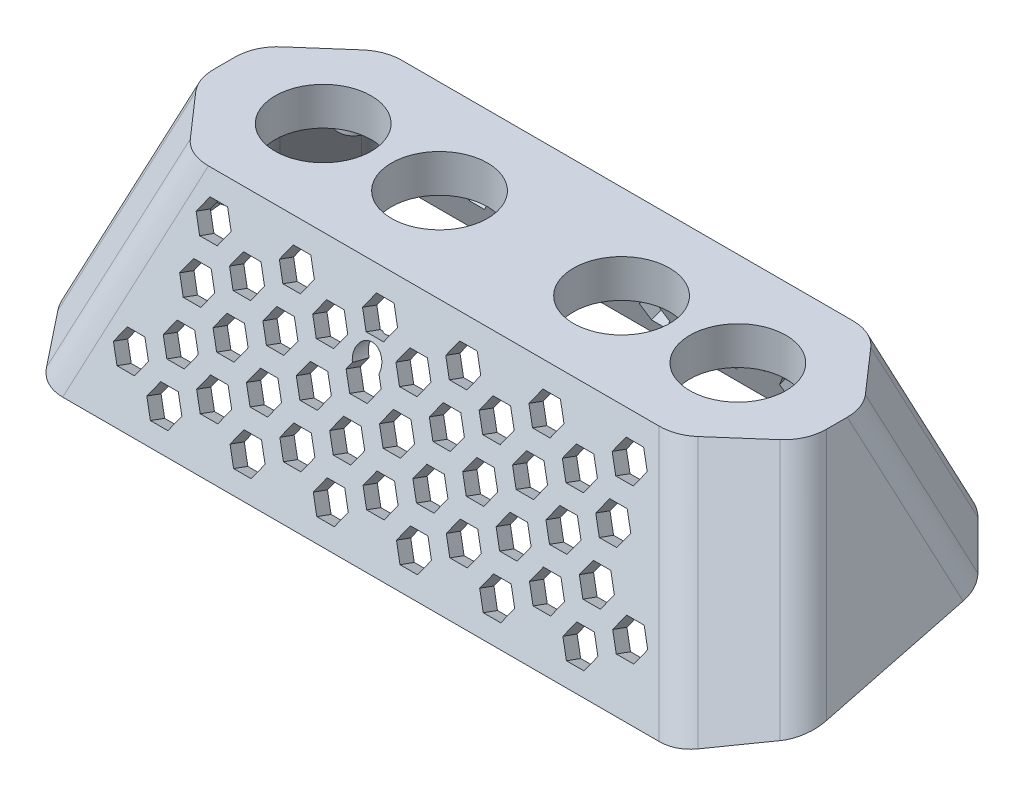
from build123d import *
from OCP.BRepFilletAPI import BRepFilletAPI_MakeChamfer

# Parameters (mm, degrees)
SKETCH1_W               = 118
SKETCH1_H               = 33
BOSS_EXTRUDE1_DEPTH     = 36
BOSS_EXTRUDE1_DRAFT     = 20
CHAMFER1_SIZE           = 10
CHAMFER1_SIZE2          = 11.413482753
CUT_EXTRUDE1_DEPTH      = 86.855492897
CUT_EXTRUDE1_DEPTH_BACK = 86.855492897
FILLET1_R               = 6
SHELL1_T                = 3
CUT_EXTRUDE2_REACH      = 91.279
SKETCH3_R               = 9.5
SKETCH4_R               = 3
SKETCH4_R_2             = 1.55
BOSS_EXTRUDE2_DEPTH     = 6
BOSS_EXTRUDE3_START     = -4.5
SKETCH5_R               = 10.5
SKETCH5_R_2             = 9.5
BOSS_EXTRUDE3_DEPTH     = 4.5
SKETCH6_W               = 12
SKETCH6_H               = 10
CUT_EXTRUDE3_DEPTH      = 90.278569771
FILL_START              = 15.504928243
FILL_PATTERN1_DEPTH     = 3
FILL_PATTERN3_DEPTH     = 3
SKETCH7_R               = 2.75
CUT_EXTRUDE4_DEPTH      = 90.278569771
CHAMFER2_SIZE           = 1


with BuildPart() as part:
    # Sketch1 → Boss-Extrude1 (with draft: the straight prism first)
    with BuildSketch(Plane(origin=(0, 0, 0), x_dir=(1, 0, 0), z_dir=(0, 1, 0))):
        Rectangle(SKETCH1_W, SKETCH1_H)
    extrude(amount=-BOSS_EXTRUDE1_DEPTH)
    # Boss-Extrude1: the draft: its side faces are tilted about the plane it starts from
    boss_extrude1_sides = [part.faces().sort_by_distance(p)[0] for p in [
        (0, -18, 16.5),
        (59, -18, 0),
        (0, -18, -16.5),
        (-59, -18, 0),
    ]]
    draft(boss_extrude1_sides, Plane(origin=(0, 0, 0), x_dir=(1, 0, 0), z_dir=(0, 1, 0)), BOSS_EXTRUDE1_DRAFT)

    # Chamfer1: one chamfer whose edges measure the first distance from different faces: ONE call of the kernel's chamfer builder (chamfer() names one face for all edges)
    chamfer1_edges_1 = [part.edges().sort_by_distance(p)[0] for p in [
        (-65.551464217, -18, -23.051464217),
    ]]
    chamfer1_side_1 = [part.faces().sort_by_distance(p)[0] for p in [
        (-66.172128816, -19.705261971, 0),
    ]]
    chamfer1_edges_2 = [part.edges().sort_by_distance(p)[0] for p in [
        (65.551464217, -18, -23.051464217),
    ]]
    chamfer1_side_2 = [part.faces().sort_by_distance(p)[0] for p in [
        (0, -18.599662964, -23.269723686),
    ]]
    chamfer1_edges_3 = [part.edges().sort_by_distance(p)[0] for p in [
        (65.551464217, -18, 23.051464217),
    ]]
    chamfer1_side_3 = [part.faces().sort_by_distance(p)[0] for p in [
        (66.172128816, -19.705261971, 0),
    ]]
    chamfer1_edges_4 = [part.edges().sort_by_distance(p)[0] for p in [
        (-65.551464217, -18, 23.051464217),
    ]]
    chamfer1_side_4 = [part.faces().sort_by_distance(p)[0] for p in [
        (0, -18.599662964, 23.269723686),
    ]]
    chamfer1 = BRepFilletAPI_MakeChamfer(part.part.solid().wrapped)
    for e in chamfer1_edges_1:
        chamfer1.Add(CHAMFER1_SIZE, CHAMFER1_SIZE2, e.wrapped, chamfer1_side_1[0].wrapped)  # the first distance lies on this face
    for e in chamfer1_edges_2:
        chamfer1.Add(CHAMFER1_SIZE, CHAMFER1_SIZE2, e.wrapped, chamfer1_side_2[0].wrapped)  # the first distance lies on this face
    for e in chamfer1_edges_3:
        chamfer1.Add(CHAMFER1_SIZE, CHAMFER1_SIZE2, e.wrapped, chamfer1_side_3[0].wrapped)  # the first distance lies on this face
    for e in chamfer1_edges_4:
        chamfer1.Add(CHAMFER1_SIZE, CHAMFER1_SIZE2, e.wrapped, chamfer1_side_4[0].wrapped)  # the first distance lies on this face
    add(Compound.cast(chamfer1.Shape()), mode=Mode.REPLACE)

    # Sketch2 → Cut-Extrude1 (cut, two sides: drawn at the far end of the back side and taken through both)
    with BuildSketch(Plane(origin=(0, 0, 0), x_dir=(0, 0, -1), z_dir=(1, 0, 0)).offset(-CUT_EXTRUDE1_DEPTH_BACK)):
        Polygon((-29.602928434, -36), (29.602928434, -25.560410018), (29.602928434, -36), align=None)
    extrude(amount=CUT_EXTRUDE1_DEPTH + CUT_EXTRUDE1_DEPTH_BACK, mode=Mode.SUBTRACT)

    # Fillet1
    fillet1_edges = [part.edges().sort_by_distance(p)[0] for p in [
        (53.197472242, -13.094997165, -21.266189186),
        (-64.084874996, -13.970579233, -11.016158052),
        (53.48887736, -18, 23.051464217),
        (-54.982747273, -18, 23.051464217),
        (65.189068085, -17.00432481, 12.12035114),
        (64.129920686, -14.094341248, -9.567333829),
        (-65.137844016, -16.863587839, 10.57525716),
        (-51.703602329, -13.094997165, -21.266189186),
    ]]
    fillet(fillet1_edges, radius=FILLET1_R)

    # Shell1
    shell1_openings = [part.faces().sort_by_distance(p)[0] for p in [
        (-4.083e-06, -31.130053435, 1.984089019),
    ]]
    offset(amount=SHELL1_T, openings=shell1_openings, kind=Kind.INTERSECTION)

    # Sketch3 → Cut-Extrude2 (cut, up to next)
    with BuildSketch(Plane(origin=(0, 0, 0), x_dir=(-1, 0, 0), z_dir=(0, -1, 0)), mode=Mode.PRIVATE) as cut_extrude2_sk1:
        with Locations(Location((-41, 0, 0), (0, 0, 90))):
            Circle(SKETCH3_R)
    cut_extrude2_tool1 = extrude(cut_extrude2_sk1.sketch, amount=-CUT_EXTRUDE2_REACH, mode=Mode.PRIVATE) & part.part
    # Sketch3 → Cut-Extrude2 (cut, up to next)
    with BuildSketch(Plane(origin=(0, 0, 0), x_dir=(-1, 0, 0), z_dir=(0, -1, 0)), mode=Mode.PRIVATE) as cut_extrude2_sk2:
        with Locations(Location((-18, 0, 0), (0, 0, 90))):
            Circle(SKETCH3_R)
    cut_extrude2_tool2 = extrude(cut_extrude2_sk2.sketch, amount=-CUT_EXTRUDE2_REACH, mode=Mode.PRIVATE) & part.part
    # Sketch3 → Cut-Extrude2 (cut, up to next)
    with BuildSketch(Plane(origin=(0, 0, 0), x_dir=(-1, 0, 0), z_dir=(0, -1, 0)), mode=Mode.PRIVATE) as cut_extrude2_sk3:
        with Locations(Location((18, 0, 0), (0, 0, 90))):
            Circle(SKETCH3_R)
    cut_extrude2_tool3 = extrude(cut_extrude2_sk3.sketch, amount=-CUT_EXTRUDE2_REACH, mode=Mode.PRIVATE) & part.part
    # Sketch3 → Cut-Extrude2 (cut, up to next)
    with BuildSketch(Plane(origin=(0, 0, 0), x_dir=(-1, 0, 0), z_dir=(0, -1, 0)), mode=Mode.PRIVATE) as cut_extrude2_sk4:
        with Locations(Location((41, 0, 0), (0, 0, 90))):
            Circle(SKETCH3_R)
    cut_extrude2_tool4 = extrude(cut_extrude2_sk4.sketch, amount=-CUT_EXTRUDE2_REACH, mode=Mode.PRIVATE) & part.part
    add(cut_extrude2_tool1.solids().sort_by_distance((41, 0, 0))[0], mode=Mode.SUBTRACT)
    add(cut_extrude2_tool2.solids().sort_by_distance((18, 0, 0))[0], mode=Mode.SUBTRACT)
    add(cut_extrude2_tool3.solids().sort_by_distance((-18, 0, 0))[0], mode=Mode.SUBTRACT)
    add(cut_extrude2_tool4.solids().sort_by_distance((-41, 0, 0))[0], mode=Mode.SUBTRACT)

    # Sketch4 → Boss-Extrude2 (add)
    # profile 1 of 4: a face of its own
    with BuildSketch(Plane(origin=(0, 0, 0), x_dir=(-1, 0, 0), z_dir=(0, 1, 0))):
        with Locations(Location((-47, 12, 0), (0, 0, 90))):
            Circle(SKETCH4_R)
        with Locations(Location((-47, 12, 0), (0, 0, 90))):
            Circle(SKETCH4_R_2, mode=Mode.SUBTRACT)
    # profile 2 of 4: a face of its own
    with BuildSketch(Plane(origin=(0, 0, 0), x_dir=(-1, 0, 0), z_dir=(0, 1, 0))):
        with Locations(Location((-47, -12, 0), (0, 0, 90))):
            Circle(SKETCH4_R)
        with Locations(Location((-47, -12, 0), (0, 0, 90))):
            Circle(SKETCH4_R_2, mode=Mode.SUBTRACT)
    # profile 3 of 4: a face of its own
    with BuildSketch(Plane(origin=(0, 0, 0), x_dir=(-1, 0, 0), z_dir=(0, 1, 0))):
        with Locations(Location((47, -12, 0), (0, 0, 90))):
            Circle(SKETCH4_R)
        with Locations(Location((47, -12, 0), (0, 0, 90))):
            Circle(SKETCH4_R_2, mode=Mode.SUBTRACT)
    # profile 4 of 4: a face of its own
    with BuildSketch(Plane(origin=(0, 0, 0), x_dir=(-1, 0, 0), z_dir=(0, 1, 0))):
        with Locations(Location((47, 12, 0), (0, 0, 90))):
            Circle(SKETCH4_R)
        with Locations(Location((47, 12, 0), (0, 0, 90))):
            Circle(SKETCH4_R_2, mode=Mode.SUBTRACT)
    extrude(amount=-BOSS_EXTRUDE2_DEPTH)

    # Sketch5 → Boss-Extrude3 (add)
    # profile 1 of 4: a face of its own
    with BuildSketch(Plane(origin=(0, 0, 0), x_dir=(-1, 0, 0), z_dir=(0, 1, 0)).offset(BOSS_EXTRUDE3_START)):
        with Locations((-41, 0)):
            Circle(SKETCH5_R)
        with Locations(Location((-41, 0, 0), (0, 0, 270))):
            Circle(SKETCH5_R_2, mode=Mode.SUBTRACT)
    # profile 2 of 4: a face of its own
    with BuildSketch(Plane(origin=(0, 0, 0), x_dir=(-1, 0, 0), z_dir=(0, 1, 0)).offset(BOSS_EXTRUDE3_START)):
        with Locations(Location((-18, 0, 0), (0, 0, 90))):
            Circle(SKETCH5_R)
        with Locations(Location((-18, 0, 0), (0, 0, 270))):
            Circle(SKETCH5_R_2, mode=Mode.SUBTRACT)
    # profile 3 of 4: a face of its own
    with BuildSketch(Plane(origin=(0, 0, 0), x_dir=(-1, 0, 0), z_dir=(0, 1, 0)).offset(BOSS_EXTRUDE3_START)):
        with Locations(Location((18, 0, 0), (0, 0, 90))):
            Circle(SKETCH5_R)
        with Locations(Location((18, 0, 0), (0, 0, 270))):
            Circle(SKETCH5_R_2, mode=Mode.SUBTRACT)
    # profile 4 of 4: a face of its own
    with BuildSketch(Plane(origin=(0, 0, 0), x_dir=(-1, 0, 0), z_dir=(0, 1, 0)).offset(BOSS_EXTRUDE3_START)):
        with Locations((41, 0)):
            Circle(SKETCH5_R)
        with Locations(Location((41, 0, 0), (0, 0, 270))):
            Circle(SKETCH5_R_2, mode=Mode.SUBTRACT)
    extrude(amount=BOSS_EXTRUDE3_DEPTH)

    # Sketch6 → Cut-Extrude3 (cut, through all)
    with BuildSketch(Plane.XY):
        with Locations((0, -11)):
            Rectangle(SKETCH6_W, SKETCH6_H)
    extrude(amount=-CUT_EXTRUDE3_DEPTH, mode=Mode.SUBTRACT)

    # Fill Pattern1: read off the stored shape, not the designer's step
    # Fill Pattern1 outline → Fill Pattern1 (cut)
    with BuildSketch(Plane(origin=(0, 0, 0), x_dir=(1, 0, 0), z_dir=(0, 0.34202014332566905, -0.9396926207859082)).offset(FILL_START)):
        Polygon((43.603316898, 24.980661067), (45.103316898, 27.578737279), (43.603316898, 30.17681349), (40.603316898, 30.17681349), (39.103316898, 27.578737279), (40.603316898, 24.980661067), align=None)
        Polygon((36.675113667, 12.980661067), (38.175113667, 15.578737279), (36.675113667, 18.17681349), (33.675113667, 18.17681349), (32.175113667, 15.578737279), (33.675113667, 12.980661067), align=None)
        Polygon((-28.678715405, 24.980661067), (-25.678715405, 24.980661067), (-24.178715405, 27.578737279), (-25.678715405, 30.17681349), (-28.678715405, 30.17681349), (-30.178715405, 27.578737279), align=None)
        Polygon((-14.822308945, 24.980661067), (-11.822308945, 24.980661067), (-10.322308945, 27.578737279), (-11.822308945, 30.17681349), (-14.822308945, 30.17681349), (-16.322308945, 27.578737279), align=None)
        Polygon((-0.965902484, 24.980661067), (2.034097516, 24.980661067), (3.534097516, 27.578737279), (2.034097516, 30.17681349), (-0.965902484, 30.17681349), (-2.465902484, 27.578737279), align=None)
        Polygon((12.890503976, 24.980661067), (15.890503976, 24.980661067), (17.390503976, 27.578737279), (15.890503976, 30.17681349), (12.890503976, 30.17681349), (11.390503976, 27.578737279), align=None)
        Polygon((26.746910437, 24.980661067), (29.746910437, 24.980661067), (31.246910437, 27.578737279), (29.746910437, 30.17681349), (26.746910437, 30.17681349), (25.246910437, 27.578737279), align=None)
        Polygon((-25.678715405, 8.980661067), (-24.178715405, 11.578737279), (-25.678715405, 14.17681349), (-28.678715405, 14.17681349), (-30.178715405, 11.578737279), (-28.678715405, 8.980661067), align=None)
        Polygon((26.746910437, 8.980661067), (29.746910437, 8.980661067), (31.246910437, 11.578737279), (29.746910437, 14.17681349), (26.746910437, 14.17681349), (25.246910437, 11.578737279), align=None)
        Polygon((-14.822308945, 8.980661067), (-11.822308945, 8.980661067), (-10.322308945, 11.578737279), (-11.822308945, 14.17681349), (-14.822308945, 14.17681349), (-16.322308945, 11.578737279), align=None)
        Polygon((40.603316898, 8.980661067), (43.603316898, 8.980661067), (45.103316898, 11.578737279), (43.603316898, 14.17681349), (40.603316898, 14.17681349), (39.103316898, 11.578737279), align=None)
        Polygon((-42.535121866, 8.980661067), (-39.535121866, 8.980661067), (-38.035121866, 11.578737279), (-39.535121866, 14.17681349), (-42.535121866, 14.17681349), (-44.035121866, 11.578737279), align=None)
        Polygon((12.890503976, 8.980661067), (15.890503976, 8.980661067), (17.390503976, 11.578737279), (15.890503976, 14.17681349), (12.890503976, 14.17681349), (11.390503976, 11.578737279), align=None)
        Polygon((-37.106918636, 23.578737279), (-35.606918636, 20.980661067), (-32.606918636, 20.980661067), (-31.106918636, 23.578737279), (-32.606918636, 26.17681349), (-35.606918636, 26.17681349), align=None)
        Polygon((-25.678715405, 16.980661067), (-24.178715405, 19.578737279), (-25.678715405, 22.17681349), (-28.678715405, 22.17681349), (-30.178715405, 19.578737279), (-28.678715405, 16.980661067), align=None)
        Polygon((-42.535121866, 16.980661067), (-39.535121866, 16.980661067), (-38.035121866, 19.578737279), (-39.535121866, 22.17681349), (-42.535121866, 22.17681349), (-44.035121866, 19.578737279), align=None)
        Polygon((40.603316898, 16.980661067), (43.603316898, 16.980661067), (45.103316898, 19.578737279), (43.603316898, 22.17681349), (40.603316898, 22.17681349), (39.103316898, 19.578737279), align=None)
        Polygon((26.746910437, 16.980661067), (29.746910437, 16.980661067), (31.246910437, 19.578737279), (29.746910437, 22.17681349), (26.746910437, 22.17681349), (25.246910437, 19.578737279), align=None)
        Polygon((12.890503976, 16.980661067), (15.890503976, 16.980661067), (17.390503976, 19.578737279), (15.890503976, 22.17681349), (12.890503976, 22.17681349), (11.390503976, 19.578737279), align=None)
        Polygon((-21.750512175, 12.980661067), (-18.750512175, 12.980661067), (-17.250512175, 15.578737279), (-18.750512175, 18.17681349), (-21.750512175, 18.17681349), (-23.250512175, 15.578737279), align=None)
        Polygon((-35.606918636, 12.980661067), (-32.606918636, 12.980661067), (-31.106918636, 15.578737279), (-32.606918636, 18.17681349), (-35.606918636, 18.17681349), (-37.106918636, 15.578737279), align=None)
        Polygon((19.818707207, 12.980661067), (22.818707207, 12.980661067), (24.318707207, 15.578737279), (22.818707207, 18.17681349), (19.818707207, 18.17681349), (18.318707207, 15.578737279), align=None)
        Polygon((36.675113667, 20.980661067), (38.175113667, 23.578737279), (36.675113667, 26.17681349), (33.675113667, 26.17681349), (32.175113667, 23.578737279), (33.675113667, 20.980661067), align=None)
        Polygon((18.318707207, 23.578737279), (19.818707207, 20.980661067), (22.818707207, 20.980661067), (24.318707207, 23.578737279), (22.818707207, 26.17681349), (19.818707207, 26.17681349), align=None)
    extrude(amount=FILL_PATTERN1_DEPTH, mode=Mode.SUBTRACT)

    # Fill Pattern3: read off the stored shape, not the designer's step
    # Fill Pattern3 outline → Fill Pattern3 (cut)
    with BuildSketch(Plane(origin=(0, 0, 0), x_dir=(1, 0, 0), z_dir=(0, 0.34202014332566905, 0.9396926207859082)).offset(FILL_START)):
        Polygon((42.334159971, -13.548532269), (44.066210779, -10.548532269), (42.334159971, -7.548532269), (38.870058356, -7.548532269), (37.138007549, -10.548532269), (38.870058356, -13.548532269), align=None)
        Polygon((25.8796773, -42.048532269), (27.611728107, -39.048532269), (25.8796773, -36.048532269), (22.415575684, -36.048532269), (20.683524877, -39.048532269), (22.415575684, -42.048532269), align=None)
        Polygon((34.106918636, -27.798532269), (35.838969443, -24.798532269), (34.106918636, -21.798532269), (30.64281702, -21.798532269), (28.910766213, -24.798532269), (30.64281702, -27.798532269), align=None)
        Polygon((-43.402355003, -13.548532269), (-39.938253388, -13.548532269), (-38.20620258, -10.548532269), (-39.938253388, -7.548532269), (-43.402355003, -7.548532269), (-45.134405811, -10.548532269), align=None)
        Polygon((-26.947872331, -13.548532269), (-23.483770716, -13.548532269), (-21.751719909, -10.548532269), (-23.483770716, -7.548532269), (-26.947872331, -7.548532269), (-28.679923139, -10.548532269), align=None)
        Polygon((-10.493389659, -13.548532269), (-7.029288044, -13.548532269), (-5.297237237, -10.548532269), (-7.029288044, -7.548532269), (-10.493389659, -7.548532269), (-12.225440467, -10.548532269), align=None)
        Polygon((5.961093013, -13.548532269), (9.425194628, -13.548532269), (11.157245435, -10.548532269), (9.425194628, -7.548532269), (5.961093013, -7.548532269), (4.229042205, -10.548532269), align=None)
        Polygon((22.415575684, -13.548532269), (25.8796773, -13.548532269), (27.611728107, -10.548532269), (25.8796773, -7.548532269), (22.415575684, -7.548532269), (20.683524877, -10.548532269), align=None)
        Polygon((17.652435964, -37.298532269), (19.384486771, -34.298532269), (17.652435964, -31.298532269), (14.188334348, -31.298532269), (12.456283541, -34.298532269), (14.188334348, -37.298532269), align=None)
        Polygon((25.8796773, -23.048532269), (27.611728107, -20.048532269), (25.8796773, -17.048532269), (22.415575684, -17.048532269), (20.683524877, -20.048532269), (22.415575684, -23.048532269), align=None)
        Polygon((30.64281702, -37.298532269), (34.106918636, -37.298532269), (35.838969443, -34.298532269), (34.106918636, -31.298532269), (30.64281702, -31.298532269), (28.910766213, -34.298532269), align=None)
        Polygon((47.097299692, -37.298532269), (50.561401307, -37.298532269), (52.293452115, -34.298532269), (50.561401307, -31.298532269), (47.097299692, -31.298532269), (45.365248885, -34.298532269), align=None)
        Polygon((-2.266148323, -37.298532269), (1.197953292, -37.298532269), (2.930004099, -34.298532269), (1.197953292, -31.298532269), (-2.266148323, -31.298532269), (-3.998199131, -34.298532269), align=None)
        Polygon((-35.175113667, -37.298532269), (-31.711012052, -37.298532269), (-29.978961245, -34.298532269), (-31.711012052, -31.298532269), (-35.175113667, -31.298532269), (-36.907164475, -34.298532269), align=None)
        Polygon((-51.629596339, -37.298532269), (-48.165494724, -37.298532269), (-46.433443916, -34.298532269), (-48.165494724, -31.298532269), (-51.629596339, -31.298532269), (-53.361647147, -34.298532269), align=None)
        Polygon((-18.720630995, -37.298532269), (-15.25652938, -37.298532269), (-13.524478573, -34.298532269), (-15.25652938, -31.298532269), (-18.720630995, -31.298532269), (-20.452681803, -34.298532269), align=None)
        Polygon((4.229042205, -20.048532269), (5.961093013, -23.048532269), (9.425194628, -23.048532269), (11.157245435, -20.048532269), (9.425194628, -17.048532269), (5.961093013, -17.048532269), align=None)
        Polygon((42.334159971, -23.048532269), (44.066210779, -20.048532269), (42.334159971, -17.048532269), (38.870058356, -17.048532269), (37.138007549, -20.048532269), (38.870058356, -23.048532269), align=None)
        Polygon((-7.029288044, -42.048532269), (-5.297237237, -39.048532269), (-7.029288044, -36.048532269), (-10.493389659, -36.048532269), (-12.225440467, -39.048532269), (-10.493389659, -42.048532269), align=None)
        Polygon((1.197953292, -27.798532269), (2.930004099, -24.798532269), (1.197953292, -21.798532269), (-2.266148323, -21.798532269), (-3.998199131, -24.798532269), (-2.266148323, -27.798532269), align=None)
        Polygon((5.961093013, -42.048532269), (9.425194628, -42.048532269), (11.157245435, -39.048532269), (9.425194628, -36.048532269), (5.961093013, -36.048532269), (4.229042205, -39.048532269), align=None)
        Polygon((38.870058356, -42.048532269), (42.334159971, -42.048532269), (44.066210779, -39.048532269), (42.334159971, -36.048532269), (38.870058356, -36.048532269), (37.138007549, -39.048532269), align=None)
        Polygon((-43.402355003, -42.048532269), (-39.938253388, -42.048532269), (-38.20620258, -39.048532269), (-39.938253388, -36.048532269), (-43.402355003, -36.048532269), (-45.134405811, -39.048532269), align=None)
        Polygon((-26.947872331, -42.048532269), (-23.483770716, -42.048532269), (-21.751719909, -39.048532269), (-23.483770716, -36.048532269), (-26.947872331, -36.048532269), (-28.679923139, -39.048532269), align=None)
        Polygon((-20.452681803, -24.798532269), (-18.720630995, -27.798532269), (-15.25652938, -27.798532269), (-13.524478573, -24.798532269), (-15.25652938, -21.798532269), (-18.720630995, -21.798532269), align=None)
        Polygon((17.652435964, -27.798532269), (19.384486771, -24.798532269), (17.652435964, -21.798532269), (14.188334348, -21.798532269), (12.456283541, -24.798532269), (14.188334348, -27.798532269), align=None)
        Polygon((-12.225440467, -20.048532269), (-10.493389659, -23.048532269), (-7.029288044, -23.048532269), (-5.297237237, -20.048532269), (-7.029288044, -17.048532269), (-10.493389659, -17.048532269), align=None)
        Polygon((-31.711012052, -27.798532269), (-29.978961245, -24.798532269), (-31.711012052, -21.798532269), (-35.175113667, -21.798532269), (-36.907164475, -24.798532269), (-35.175113667, -27.798532269), align=None)
        Polygon((-31.711012052, -18.298532269), (-29.978961245, -15.298532269), (-31.711012052, -12.298532269), (-35.175113667, -12.298532269), (-36.907164475, -15.298532269), (-35.175113667, -18.298532269), align=None)
        Polygon((-39.938253388, -32.548532269), (-38.20620258, -29.548532269), (-39.938253388, -26.548532269), (-43.402355003, -26.548532269), (-45.134405811, -29.548532269), (-43.402355003, -32.548532269), align=None)
        Polygon((-18.720630995, -18.298532269), (-15.25652938, -18.298532269), (-13.524478573, -15.298532269), (-15.25652938, -12.298532269), (-18.720630995, -12.298532269), (-20.452681803, -15.298532269), align=None)
        Polygon((-2.266148323, -18.298532269), (1.197953292, -18.298532269), (2.930004099, -15.298532269), (1.197953292, -12.298532269), (-2.266148323, -12.298532269), (-3.998199131, -15.298532269), align=None)
        Polygon((14.188334348, -18.298532269), (17.652435964, -18.298532269), (19.384486771, -15.298532269), (17.652435964, -12.298532269), (14.188334348, -12.298532269), (12.456283541, -15.298532269), align=None)
        Polygon((30.64281702, -18.298532269), (34.106918636, -18.298532269), (35.838969443, -15.298532269), (34.106918636, -12.298532269), (30.64281702, -12.298532269), (28.910766213, -15.298532269), align=None)
        Polygon((-28.679923139, -29.548532269), (-26.947872331, -32.548532269), (-23.483770716, -32.548532269), (-21.751719909, -29.548532269), (-23.483770716, -26.548532269), (-26.947872331, -26.548532269), align=None)
        Polygon((-23.483770716, -23.048532269), (-21.751719909, -20.048532269), (-23.483770716, -17.048532269), (-26.947872331, -17.048532269), (-28.679923139, -20.048532269), (-26.947872331, -23.048532269), align=None)
        Polygon((-45.134405811, -20.048532269), (-43.402355003, -23.048532269), (-39.938253388, -23.048532269), (-38.20620258, -20.048532269), (-39.938253388, -17.048532269), (-43.402355003, -17.048532269), align=None)
        Polygon((-12.225440467, -29.548532269), (-10.493389659, -32.548532269), (-7.029288044, -32.548532269), (-5.297237237, -29.548532269), (-7.029288044, -26.548532269), (-10.493389659, -26.548532269), align=None)
        Polygon((4.229042205, -29.548532269), (5.961093013, -32.548532269), (9.425194628, -32.548532269), (11.157245435, -29.548532269), (9.425194628, -26.548532269), (5.961093013, -26.548532269), align=None)
        Polygon((20.683524877, -29.548532269), (22.415575684, -32.548532269), (25.8796773, -32.548532269), (27.611728107, -29.548532269), (25.8796773, -26.548532269), (22.415575684, -26.548532269), align=None)
        Polygon((37.138007549, -29.548532269), (38.870058356, -32.548532269), (42.334159971, -32.548532269), (44.066210779, -29.548532269), (42.334159971, -26.548532269), (38.870058356, -26.548532269), align=None)
    extrude(amount=FILL_PATTERN3_DEPTH, mode=Mode.SUBTRACT)

    # Sketch7 → Cut-Extrude4 (cut, through all)
    with BuildSketch(Plane.XY):
        with Locations((-9, -10)):
            Circle(SKETCH7_R)
    extrude(amount=CUT_EXTRUDE4_DEPTH, mode=Mode.SUBTRACT)

    # Chamfer2
    # the kernel refuses this chamfer: 1 mm, written as the material it adds along each edge
    with BuildSketch(Plane(origin=(47, 0, -12), x_dir=(0, 0, 1), z_dir=(-1, 0, 0))) as chamfer2_piece_1_section:
        Polygon((3 + CHAMFER2_SIZE, 0), (3, -CHAMFER2_SIZE), (3, 0), align=None)
    chamfer2_piece_1 = revolve(axis=Axis((47, 0, -12), (0, 1, 0)), revolution_arc=359.64, mode=Mode.PRIVATE)
    chamfer2_piece_1 = chamfer2_piece_1 - Plane(origin=(41, 0, 0), x_dir=(0, 0, -1), z_dir=(0, -1, 0)) * Cylinder(9.5, 17, mode=Mode.PRIVATE)
    add(chamfer2_piece_1)
    with BuildSketch(Plane(origin=(47, 0, 12), x_dir=(0, 0, 1), z_dir=(-1, 0, 0))) as chamfer2_piece_2_section:
        Polygon((3 + CHAMFER2_SIZE, 0), (3, -CHAMFER2_SIZE), (3, 0), align=None)
    chamfer2_piece_2 = revolve(axis=Axis((47, 0, 12), (0, 1, 0)), revolution_arc=278.254893153, mode=Mode.PRIVATE)
    chamfer2_piece_2 = chamfer2_piece_2 - Plane(origin=(41, 0, 0), x_dir=(0, 0, -1), z_dir=(0, -1, 0)) * Cylinder(9.5, 16, mode=Mode.PRIVATE)
    add(chamfer2_piece_2)
    with BuildSketch(Plane(origin=(-47, 0, 12), x_dir=(0.9896391287066973, 0, 0.14357713931071614), z_dir=(-0.14357713931071614, 0, 0.9896391287066973))) as chamfer2_piece_3_section:
        Polygon((3 + CHAMFER2_SIZE, 0), (3, -CHAMFER2_SIZE), (3, 0), align=None)
    chamfer2_piece_3 = revolve(axis=Axis((-47, 0, 12), (0, 1, 0)), revolution_arc=278.254893153, mode=Mode.PRIVATE)
    chamfer2_piece_3 = chamfer2_piece_3 - Plane(origin=(-41, 0, 0), x_dir=(0, 0, -1), z_dir=(0, -1, 0)) * Cylinder(9.5, 16, mode=Mode.PRIVATE)
    add(chamfer2_piece_3)
    with BuildSketch(Plane(origin=(-47, 0, -12), x_dir=(0.006283143965556328, 0, 0.9999802608561371), z_dir=(-0.9999802608561371, 0, 0.006283143965556328))) as chamfer2_piece_4_section:
        Polygon((3 + CHAMFER2_SIZE, 0), (3, -CHAMFER2_SIZE), (3, 0), align=None)
    chamfer2_piece_4 = revolve(axis=Axis((-47, 0, -12), (0, 1, 0)), revolution_arc=359.64, mode=Mode.PRIVATE)
    chamfer2_piece_4 = chamfer2_piece_4 - Plane(origin=(-41, 0, 0), x_dir=(0, 0, -1), z_dir=(0, -1, 0)) * Cylinder(9.5, 17, mode=Mode.PRIVATE)
    add(chamfer2_piece_4)
    with BuildSketch(Plane(origin=(-47, 0, -12), x_dir=(0, 0, 1), z_dir=(-1, 0, 0))) as chamfer2_piece_5_section:
        Polygon((3 + CHAMFER2_SIZE, 0), (3, -CHAMFER2_SIZE), (3, 0), align=None)
    chamfer2_piece_5 = revolve(axis=Axis((-47, 0, -12), (0, 1, 0)), revolution_arc=98.098799205, mode=Mode.PRIVATE)
    chamfer2_piece_5 = chamfer2_piece_5 - Plane(origin=(-41, 0, 0), x_dir=(0, 0, -1), z_dir=(0, -1, 0)) * Cylinder(9.5, 16, mode=Mode.PRIVATE)
    add(chamfer2_piece_5)
    with BuildSketch(Plane(origin=(-47, 0, 12), x_dir=(0, 0, 1), z_dir=(-1, 0, 0))) as chamfer2_piece_6_section:
        Polygon((3 + CHAMFER2_SIZE, 0), (3, -CHAMFER2_SIZE), (3, 0), align=None)
    chamfer2_piece_6 = revolve(axis=Axis((-47, 0, 12), (0, 1, 0)), revolution_arc=225.050724906, mode=Mode.PRIVATE)
    chamfer2_piece_6 = chamfer2_piece_6 - Plane(origin=(-41, 0, 0), x_dir=(0, 0, -1), z_dir=(0, -1, 0)) * Cylinder(9.5, 17, mode=Mode.PRIVATE)
    add(chamfer2_piece_6)
    with BuildSketch(Plane(origin=(47, 0, 12), x_dir=(0.7077325173852933, 0, -0.7064804907677746), z_dir=(0.7064804907677746, 0, 0.7077325173852933))) as chamfer2_piece_7_section:
        Polygon((3 + CHAMFER2_SIZE, 0), (3, -CHAMFER2_SIZE), (3, 0), align=None)
    chamfer2_piece_7 = revolve(axis=Axis((47, 0, 12), (0, 1, 0)), revolution_arc=225.050724906, mode=Mode.PRIVATE)
    chamfer2_piece_7 = chamfer2_piece_7 - Plane(origin=(41, 0, 0), x_dir=(0, 0, -1), z_dir=(0, -1, 0)) * Cylinder(9.5, 17, mode=Mode.PRIVATE)
    add(chamfer2_piece_7)
    with BuildSketch(Plane(origin=(47, 0, -12), x_dir=(-0.9900266104834325, 0, -0.14088048315748236), z_dir=(0.14088048315748236, 0, -0.9900266104834325))) as chamfer2_piece_8_section:
        Polygon((3 + CHAMFER2_SIZE, 0), (3, -CHAMFER2_SIZE), (3, 0), align=None)
    chamfer2_piece_8 = revolve(axis=Axis((47, 0, -12), (0, 1, 0)), revolution_arc=98.098799205, mode=Mode.PRIVATE)
    chamfer2_piece_8 = chamfer2_piece_8 - Plane(origin=(41, 0, 0), x_dir=(0, 0, -1), z_dir=(0, -1, 0)) * Cylinder(9.5, 17, mode=Mode.PRIVATE)
    add(chamfer2_piece_8)


solid = part.part
